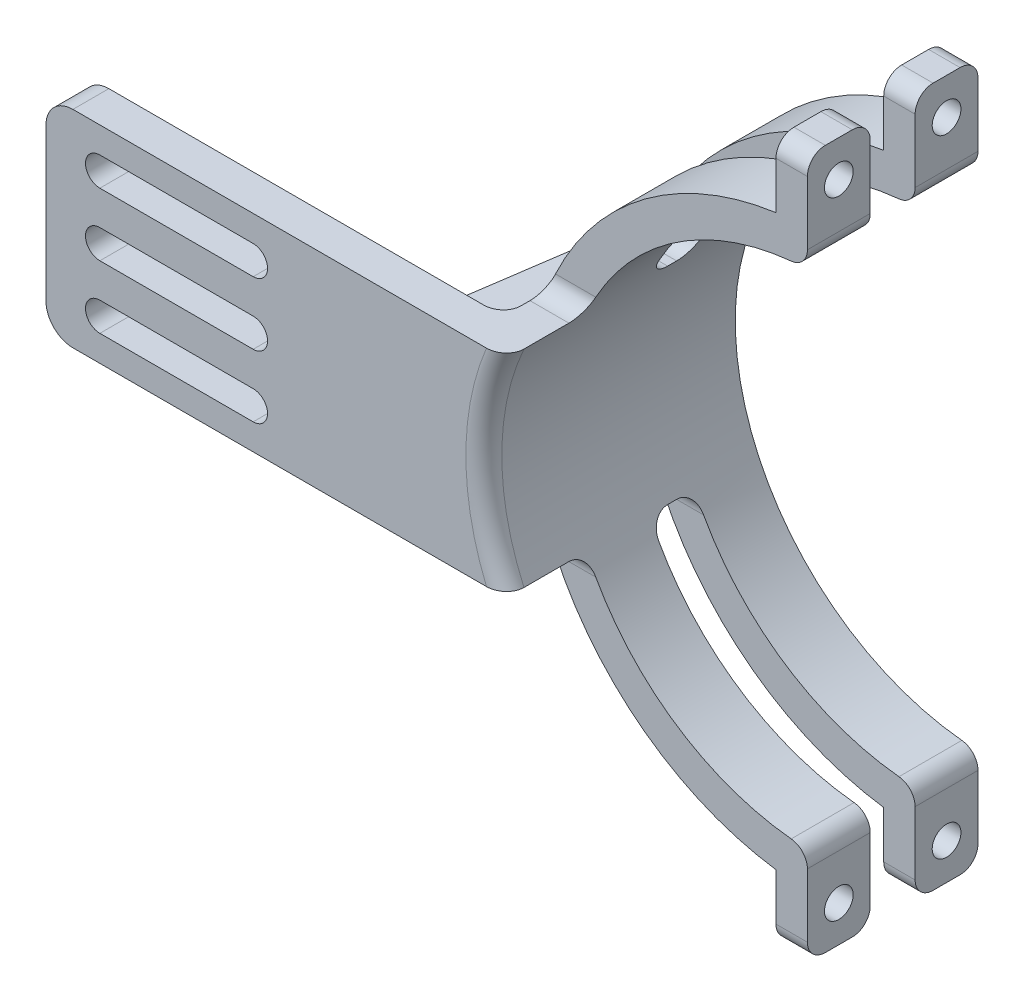
from build123d import *

# Parameters (mm, degrees)
EXTRUDE_1_DEPTH      = 3
SKETCH_7_R           = 2.2499999999999996
SKETCH_7_R_2         = 2.249999999999999
CUT_EXTRUDE_2_DEPTH  = 143.9554309486725
SKETCH_8_R           = 8
CUT_EXTRUDE_3_DEPTH  = 143.9554309486725
CUT_EXTRUDE_4_DEPTH  = 3
CUT_EXTRUDE_5_DEPTH  = 3
CUT_EXTRUDE_8_DEPTH  = 3
SKETCH_12_R          = 1.6999999999999977
SKETCH_12_R_2        = 1.6999999999999975
SKETCH_12_R_3        = 1.7000000000000015
SKETCH_12_R_4        = 1.7000000000000024
CUT_EXTRUDE_9_DEPTH  = 3
SKETCH_13_R          = 1.6999999999999977
SKETCH_13_R_2        = 1.7000000000000015
SKETCH_13_R_3        = 1.6999999999999973
CUT_EXTRUDE_11_DEPTH = 3
CUT_EXTRUDE_12_DEPTH = 143.9554309486725
FILLET_1_R           = 2
FILLET_2_R           = 2
CUT_EXTRUDE_13_DEPTH = 143.9554309486725
CUT_EXTRUDE_14_DEPTH = 143.9554309486725
CUT_EXTRUDE_15_DEPTH = 143.9554309486725
CUT_EXTRUDE_16_DEPTH = 143.9554309486725
EXTRUDE_2_DEPTH      = 4
SKETCH_20_W          = 4
SKETCH_20_H          = 23
EXTRUDE_3_DEPTH      = 5
EXTRUDE_4_DEPTH      = 7
EXTRUDE_5_DEPTH      = 9
CUT_EXTRUDE_17_DEPTH = 5
EXTRUDE_6_DEPTH      = 5
EXTRUDE_7_DEPTH      = 7
SKETCH_26_R          = 1.6000000000000008
SKETCH_26_R_2        = 1.5999999999999974
SKETCH_26_R_3        = 1.5999999999999908
SKETCH_26_R_4        = 1.5999999999999979
CUT_EXTRUDE_18_DEPTH = 27.000000000000004
FILLET_3_R           = 2
FILLET_4_R           = 2
FILLET_5_R           = 2
FILLET_6_R           = 2
FILLET_7_R           = 2
FILLET_8_R           = 2
FILLET_9_R           = 2
FILLET_10_R          = 2
FILLET_11_R          = 2
FILLET_12_R          = 2
SKETCH_29_W          = 19.839717489785563
SKETCH_29_H          = 23.000000000000004
EXTRUDE_8_DEPTH      = 4
CUT_EXTRUDE_21_DEPTH = 10
FILLET_13_R          = 3
EXTRUDE_START        = -24
EXTRUDE_9_DEPTH      = 24
CUT_EXTRUDE_22_DEPTH = 10
FILLET_14_R          = 3
EXTRUDE_10_DEPTH     = 4
SKETCH_42_W          = 21.709593228890974
SKETCH_42_H          = 23.000000000000007
EXTRUDE_11_DEPTH     = 4
CUT_EXTRUDE_23_DEPTH = 10
FILLET_15_R          = 3
SKETCH_44_W          = 31.295070260946716
SKETCH_44_H          = 95.84115267414583
CUT_EXTRUDE_24_DEPTH = 30


# Read off the part's stored shape, not the designer's step: 切除-拉伸19
with BuildPart() as part:
    # 草图1 → 凸台-拉伸1 (new body)
    # profile 1 of 14: a face of its own
    with BuildSketch(Plane.XY):
        with BuildLine():
            Line((59.99999999999994, 106.6032960019551), (35.88916363361177, 121.66451915871228))
            Line((35.88916363361177, 121.66451915871228), (-35.88916363361177, 121.66451915871227))
            Line((-35.88916363361177, 121.66451915871227), (-59.99999999999998, 106.60329600195507))
            Line((-59.99999999999998, 106.60329600195509), (-59.99999999999998, 94.80189226525114))
            Line((-59.999999999999964, 94.80189226525113), (-44.999999999999964, 94.80189226525111))
            ThreePointArc((-44.999999999999964, 94.80189226525111), (-43.7625631329235, 94.28932913232757), (-43.24999999999996, 93.05189226525111))
            Line((-43.24999999999996, 93.05189226525111), (-37.74999999999997, 93.05189226525111))
            ThreePointArc((-37.74999999999997, 93.05189226525111), (-37.237436867076426, 94.28932913232757), (-35.999999999999964, 94.80189226525111))
            Line((-35.999999999999964, 94.80189226525111), (-20.999999999999964, 94.80189226525111))
            ThreePointArc((-20.999999999999964, 94.80189226525111), (-19.762563132923507, 94.28932913232757), (-19.249999999999964, 93.05189226525111))
            Line((-19.249999999999957, 93.05189226525111), (19.249999999999986, 93.05189226525111))
            ThreePointArc((19.24999999999998, 93.05189226525111), (19.76256313292352, 94.28932913232757), (20.99999999999998, 94.80189226525111))
            Line((20.99999999999998, 94.80189226525111), (35.99999999999998, 94.80189226525111))
            ThreePointArc((35.99999999999998, 94.80189226525111), (37.23743686707644, 94.28932913232757), (37.749999999999986, 93.05189226525111))
            Line((37.749999999999986, 93.05189226525111), (43.249999999999986, 93.05189226525111))
            ThreePointArc((43.24999999999997, 93.05189226525111), (43.76256313292352, 94.28932913232757), (44.99999999999998, 94.80189226525111))
            Line((44.99999999999998, 94.80189226525111), (59.99999999999997, 94.80189226525113))
            Line((59.99999999999997, 94.80189226525113), (59.99999999999997, 106.6032960019551))
        make_face()
    # profile 2 of 14: a face of its own
    with BuildSketch(Plane.XY):
        with BuildLine():
            Line((66.90169409482209, 102.29204137178812), (59.99999999999994, 106.6032960019551))
            Line((59.99999999999997, 106.6032960019551), (59.99999999999997, 94.80189226525113))
            ThreePointArc((59.99999999999997, 94.80189226525113), (61.23743686707643, 94.28932913232758), (61.74999999999998, 93.05189226525113))
            Line((61.749999999999986, 93.05189226525111), (66.9016940948221, 93.05189226525111))
            Line((66.90169409482209, 93.05189226525111), (66.90169409482209, 102.29204137178812))
        make_face()
    # profile 3 of 14: a face of its own
    with BuildSketch(Plane.XY):
        with BuildLine():
            Line((-59.99999999999998, 94.80189226525114), (-59.99999999999998, 106.60329600195509))
            Line((-59.99999999999998, 106.60329600195507), (-66.90169409482209, 102.2920413717881))
            Line((-66.90169409482209, 102.2920413717881), (-66.90169409482209, 93.05189226525111))
            Line((-66.90169409482209, 93.05189226525111), (-61.74999999999997, 93.05189226525111))
            ThreePointArc((-61.74999999999997, 93.05189226525113), (-61.237436867076426, 94.28932913232758), (-59.999999999999964, 94.80189226525113))
        make_face()
    # profile 4 of 14: a face of its own
    with BuildSketch(Plane.XY):
        with BuildLine():
            Line((66.90169409482212, 63.05189226525111), (66.90169409482209, 93.05189226525111))
            Line((66.9016940948221, 93.05189226525111), (61.749999999999986, 93.05189226525111))
            ThreePointArc((61.74999999999998, 93.05189226525113), (61.23743686707643, 91.81445539817466), (59.99999999999997, 91.30189226525113))
            Line((59.99999999999998, 91.30189226525113), (59.99999999999998, 64.80189226525113))
            ThreePointArc((59.99999999999998, 64.8018922652511), (61.23743686707643, 64.28932913232755), (61.74999999999997, 63.0518922652511))
            Line((61.749999999999986, 63.05189226525111), (66.9016940948221, 63.05189226525111))
        make_face()
    # profile 5 of 14: a face of its own
    with BuildSketch(Plane.XY):
        with BuildLine():
            Line((-61.74999999999997, 93.05189226525111), (-66.90169409482209, 93.05189226525111))
            Line((-66.90169409482209, 93.05189226525111), (-66.90169409482209, 63.05189226525111))
            Line((-66.90169409482209, 63.05189226525111), (-61.74999999999997, 63.05189226525111))
            ThreePointArc((-61.74999999999997, 63.0518922652511), (-61.237436867076426, 64.28932913232755), (-59.999999999999964, 64.8018922652511))
            Line((-59.99999999999999, 64.8018922652511), (-59.99999999999998, 91.30189226525114))
            ThreePointArc((-59.999999999999964, 91.30189226525113), (-61.237436867076426, 91.81445539817467), (-61.74999999999997, 93.05189226525113))
        make_face()
    # profile 6 of 14: a face of its own
    with BuildSketch(Plane.XY):
        with BuildLine():
            Line((66.90169409482212, 52.870133869290264), (66.90169409482212, 63.05189226525111))
            Line((66.9016940948221, 63.05189226525111), (61.749999999999986, 63.05189226525111))
            ThreePointArc((61.74999999999997, 63.0518922652511), (61.23743686707643, 61.814455398174644), (59.99999999999998, 61.3018922652511))
            Line((59.99999999999998, 61.301892265251126), (59.999999999999986, 31.261343000504525))
            Line((59.999999999999986, 31.261343000504528), (75.00000000000001, 31.26134300050453))
            Line((75.00000000000001, 31.26134300050453), (75.00000000000001, 40.93388979542704))
            ThreePointArc((75.00000000000001, 40.93388979542704), (69.11735192662594, 45.6580523194762), (66.90169409482212, 52.870133869290264))
        make_face()
    # profile 7 of 14: a face of its own
    with BuildSketch(Plane.XY):
        with BuildLine():
            Line((59.99999999999998, 64.80189226525113), (59.99999999999998, 91.30189226525113))
            Line((59.99999999999997, 91.30189226525113), (44.99999999999998, 91.30189226525111))
            ThreePointArc((44.99999999999998, 91.30189226525111), (43.76256313292352, 91.81445539817466), (43.24999999999997, 93.05189226525111))
            Line((43.249999999999986, 93.05189226525111), (37.749999999999986, 93.05189226525111))
            ThreePointArc((37.749999999999986, 93.05189226525111), (37.23743686707644, 91.81445539817466), (35.99999999999998, 91.30189226525111))
            Line((35.99999999999998, 91.30189226525111), (20.99999999999998, 91.30189226525111))
            ThreePointArc((20.99999999999998, 91.30189226525111), (19.76256313292352, 91.81445539817466), (19.24999999999998, 93.05189226525111))
            Line((19.249999999999986, 93.05189226525111), (-19.249999999999957, 93.05189226525111))
            ThreePointArc((-19.249999999999964, 93.05189226525111), (-19.762563132923507, 91.81445539817466), (-20.999999999999964, 91.30189226525111))
            Line((-20.999999999999964, 91.30189226525111), (-35.999999999999964, 91.30189226525111))
            ThreePointArc((-35.999999999999964, 91.30189226525111), (-37.237436867076426, 91.81445539817466), (-37.74999999999997, 93.05189226525111))
            Line((-37.74999999999997, 93.05189226525111), (-43.24999999999996, 93.05189226525111))
            ThreePointArc((-43.24999999999996, 93.05189226525111), (-43.7625631329235, 91.81445539817466), (-44.999999999999964, 91.30189226525111))
            Line((-44.999999999999964, 91.30189226525111), (-59.999999999999964, 91.30189226525113))
            Line((-59.99999999999998, 91.30189226525114), (-59.99999999999999, 64.8018922652511))
            Line((-59.999999999999964, 64.8018922652511), (-44.999999999999964, 64.80189226525111))
            ThreePointArc((-44.999999999999964, 64.80189226525111), (-43.7625631329235, 64.28932913232757), (-43.24999999999996, 63.05189226525111))
            Line((-43.24999999999996, 63.05189226525111), (-37.74999999999997, 63.05189226525111))
            ThreePointArc((-37.74999999999997, 63.05189226525111), (-37.237436867076426, 64.28932913232757), (-35.999999999999964, 64.80189226525111))
            Line((-35.999999999999964, 64.80189226525111), (-20.999999999999964, 64.80189226525111))
            ThreePointArc((-20.999999999999964, 64.80189226525111), (-19.762563132923507, 64.28932913232757), (-19.249999999999964, 63.05189226525111))
            Line((-19.249999999999957, 63.05189226525111), (19.24999999999997, 63.05189226525111))
            ThreePointArc((19.24999999999997, 63.05189226525111), (19.762563132923514, 64.28932913232757), (20.99999999999997, 64.80189226525111))
            Line((20.99999999999997, 64.80189226525111), (35.99999999999997, 64.80189226525111))
            ThreePointArc((35.99999999999997, 64.80189226525111), (37.23743686707643, 64.28932913232757), (37.74999999999998, 63.05189226525111))
            Line((37.749999999999986, 63.05189226525111), (43.24999999999996, 63.05189226525111))
            ThreePointArc((43.249999999999964, 63.05189226525111), (43.76256313292351, 64.28932913232757), (44.99999999999997, 64.80189226525111))
            Line((44.99999999999997, 64.80189226525111), (59.99999999999998, 64.80189226525113))
        make_face()
    # profile 8 of 14: a face of its own
    with BuildSketch(Plane.XY):
        with BuildLine():
            Line((-61.74999999999997, 63.05189226525111), (-66.90169409482209, 63.05189226525111))
            Line((-66.90169409482209, 63.05189226525111), (-66.90169409482209, 52.87013386929025))
            ThreePointArc((-66.90169409482209, 52.87013386929025), (-69.11735192662591, 45.65805231947618), (-74.99999999999999, 40.93388979542702))
            Line((-74.99999999999999, 40.93388979542702), (-74.99999999999999, 31.26134300050451))
            Line((-74.99999999999999, 31.26134300050451), (-60, 31.261343000504514))
            Line((-60, 31.26134300050451), (-59.99999999999999, 61.3018922652511))
            ThreePointArc((-59.999999999999964, 61.30189226525109), (-61.237436867076426, 61.81445539817464), (-61.74999999999997, 63.0518922652511))
        make_face()
    # profile 9 of 14: a face of its own
    with BuildSketch(Plane.XY):
        with BuildLine():
            Line((59.999999999999986, 31.261343000504525), (59.99999999999998, 61.301892265251126))
            Line((59.99999999999998, 61.30189226525112), (44.99999999999997, 61.30189226525111))
            ThreePointArc((44.99999999999997, 61.301892265251105), (43.76256313292351, 61.81445539817465), (43.249999999999964, 63.05189226525111))
            Line((43.24999999999996, 63.05189226525111), (37.749999999999986, 63.05189226525111))
            ThreePointArc((37.74999999999998, 63.05189226525111), (37.23743686707643, 61.81445539817465), (35.99999999999997, 61.301892265251105))
            Line((35.99999999999997, 61.30189226525111), (20.99999999999997, 61.30189226525111))
            ThreePointArc((20.99999999999997, 61.30189226525111), (19.762563132923514, 61.81445539817465), (19.24999999999997, 63.05189226525111))
            Line((19.24999999999997, 63.05189226525111), (-19.249999999999957, 63.05189226525111))
            ThreePointArc((-19.249999999999964, 63.05189226525111), (-19.762563132923507, 61.81445539817465), (-20.999999999999964, 61.30189226525111))
            Line((-20.999999999999964, 61.30189226525111), (-35.999999999999964, 61.30189226525111))
            ThreePointArc((-35.999999999999964, 61.301892265251105), (-37.237436867076426, 61.81445539817465), (-37.74999999999997, 63.05189226525111))
            Line((-37.74999999999997, 63.05189226525111), (-43.24999999999996, 63.05189226525111))
            ThreePointArc((-43.24999999999996, 63.05189226525111), (-43.7625631329235, 61.81445539817465), (-44.999999999999964, 61.301892265251105))
            Line((-44.999999999999964, 61.30189226525111), (-59.999999999999964, 61.3018922652511))
            Line((-59.99999999999999, 61.3018922652511), (-60, 31.26134300050451))
            Line((-60, 31.261343000504514), (59.999999999999986, 31.261343000504528))
        make_face()
    # profile 10 of 14: a face of its own
    with BuildSketch(Plane.XY):
        with BuildLine():
            Line((60.00000000000001, -58.31286428889716), (59.999999999999986, 23.940028390779446))
            Line((59.999999999999986, 23.940028390779425), (-60, 23.94002839077941))
            Line((-60, 23.940028390779403), (-60.00000000000003, -58.31286428889722))
            Line((-60.00000000000003, -58.31286428889722), (-44.99999999999997, -58.31286428889719))
            ThreePointArc((-44.99999999999997, -58.312864288897195), (-43.24999999999989, -60.06286428889721), (-44.99999999999997, -61.812864288897224))
            Line((-44.99999999999997, -61.812864288897224), (-60.00000000000006, -61.81286428889722))
            Line((-60.00000000000006, -61.81286428889722), (-60.00000000000002, -88.31286428889688))
            Line((-60.00000000000002, -88.31286428889688), (-44.99999999999999, -88.31286428889679))
            ThreePointArc((-44.99999999999999, -88.31286428889678), (-43.25000000000038, -90.06286428889678), (-44.99999999999999, -91.81286428889678))
            Line((-44.99999999999999, -91.81286428889679), (-60.000000000000014, -91.81286428889689))
            Line((-60.000000000000014, -91.81286428889689), (-60, -111.8499672560037))
            Line((-60, -111.8499672560037), (-38.845469114440476, -105.59057673322376))
            ThreePointArc((-38.845469114440476, -105.59057673322376), (-36.03778449152867, -104.97521010805474), (-33.170885730154765, -104.76866588242706))
            Line((-33.170885730154765, -104.76866588242706), (33.17088573015482, -104.76866588242706))
            ThreePointArc((33.17088573015482, -104.76866588242706), (36.03778449152872, -104.97521010805474), (38.84546911444053, -105.59057673322376))
            Line((38.84546911444053, -105.59057673322376), (60.000000000000014, -111.84996725600368))
            Line((60.000000000000014, -111.84996725600368), (60.00000000000001, -91.81286428889712))
            Line((60.00000000000007, -91.81286428889712), (45.00000000000003, -91.81286428889699))
            ThreePointArc((45.00000000000003, -91.81286428889699), (43.762563132922956, -91.30030115597347), (43.24999999999931, -90.06286428889646))
            ThreePointArc((43.24999999999931, -90.06286428889646), (43.76256313292323, -88.82542742181997), (45.00000000000002, -88.31286428889673))
            Line((45.00000000000002, -88.31286428889673), (60.00000000000006, -88.31286428889713))
            Line((60.00000000000001, -88.31286428889713), (60.00000000000001, -61.812864288897174))
            Line((60.00000000000001, -61.81286428889717), (45.000000000000036, -61.81286428889717))
            ThreePointArc((45.000000000000036, -61.812864288897174), (43.762563132923574, -61.300301155973635), (43.250000000000014, -60.062864288897174))
            ThreePointArc((43.250000000000014, -60.062864288897174), (43.76256313292355, -58.82542742182069), (45.000000000000036, -58.31286428889713))
            Line((45.000000000000036, -58.31286428889713), (60.00000000000001, -58.31286428889716))
        make_face()
        with BuildLine():
            ThreePointArc((-20.999999999999964, -88.31286428889648), (-19.76256313292351, -88.82542742182001), (-19.249999999999964, -90.06286428889646))
            ThreePointArc((-19.249999999999964, -90.06286428889646), (-19.7625631329235, -91.30030115597293), (-20.999999999999964, -91.81286428889648))
            Line((-20.999999999999964, -91.81286428889648), (-35.999999999999964, -91.81286428889648))
            ThreePointArc((-35.999999999999964, -91.81286428889648), (-37.74999999999999, -90.06286428889648), (-35.999999999999964, -88.31286428889648))
            Line((-35.999999999999964, -88.31286428889648), (-20.999999999999964, -88.31286428889648))
        make_face(mode=Mode.SUBTRACT)
        with BuildLine():
            ThreePointArc((-20.999999999999964, -58.31286428889723), (-19.762563132923184, -58.82542742182099), (-19.249999999999854, -60.06286428889795))
            ThreePointArc((-19.249999999999854, -60.06286428889795), (-19.762563132923688, -61.30030115597399), (-20.999999999999964, -61.812864288897245))
            Line((-20.999999999999964, -61.812864288897245), (-35.99999999999992, -61.81286428889731))
            ThreePointArc((-35.99999999999992, -61.81286428889731), (-37.75000000000054, -60.06286428889735), (-36.000000000000014, -58.31286428889731))
            Line((-36.000000000000014, -58.3128642888973), (-20.999999999999964, -58.31286428889723))
        make_face(mode=Mode.SUBTRACT)
        with BuildLine():
            ThreePointArc((36.00000000000002, -88.31286428889648), (37.23743686707648, -88.82542742182002), (37.75000000000002, -90.06286428889649))
            ThreePointArc((37.75000000000002, -90.06286428889649), (37.237436867076475, -91.30030115597295), (36.00000000000002, -91.81286428889648))
            Line((36.00000000000002, -91.81286428889648), (21.000000000000018, -91.81286428889648))
            ThreePointArc((21.000000000000018, -91.81286428889648), (19.762563132923546, -91.30030115597292), (19.250000000000018, -90.06286428889644))
            ThreePointArc((19.250000000000018, -90.06286428889644), (19.762563132923574, -88.82542742182001), (21.000000000000018, -88.31286428889648))
            Line((21.000000000000018, -88.31286428889648), (36.00000000000002, -88.31286428889648))
        make_face(mode=Mode.SUBTRACT)
        with BuildLine():
            ThreePointArc((36.00000000000001, -58.31286428889745), (37.2374368670764, -58.825427421820926), (37.75000000000002, -60.06286428889725))
            ThreePointArc((37.75000000000002, -60.06286428889725), (37.23743686707655, -61.30030115597386), (36.00000000000001, -61.812864288897494))
            Line((36.00000000000001, -61.812864288897494), (21.000000000000004, -61.812864288897494))
            ThreePointArc((21.000000000000004, -61.812864288897494), (19.762563132923542, -61.30030115597395), (19.249999999999993, -60.06286428889749))
            ThreePointArc((19.249999999999993, -60.06286428889749), (19.762563132923532, -58.82542742182101), (21.000000000000004, -58.31286428889745))
            Line((21.000000000000004, -58.31286428889745), (36.00000000000001, -58.31286428889745))
        make_face(mode=Mode.SUBTRACT)
    # profile 11 of 14: a face of its own
    with BuildSketch(Plane.XY):
        with BuildLine():
            Line((75.00000000000001, 23.94002839077943), (59.999999999999986, 23.940028390779425))
            Line((59.999999999999986, 23.940028390779446), (60.00000000000001, -58.31286428889716))
            ThreePointArc((60.00000000000001, -58.31286428889715), (61.237436867076404, -58.82542742182061), (61.750000000000036, -60.06286428889695))
            Line((61.750000000000036, -60.06286428889696), (67.40272133408746, -60.06286428889689))
            add(Edge.make_bspline(
                [(75.00000000000001, 10.562559835431854), (72.69587825706628, 1.9073142333592985), (70.33958253529204, -13.372796252870137), (67.81820670408499, -36.93903295106657), (67.20886038798805, -51.77269444017321), (67.40272133408746, -60.06286428889608)],
                knots=[0, 0, 0, 0, 0.23524667827066936, 0.40629418957963404, 0.6241081814572702, 0.6241081814572702, 0.6241081814572702, 0.6241081814572702], degree=3))
            Line((75.00000000000001, 10.562559835431854), (75.00000000000001, 23.94002839077943))
        make_face()
    # profile 12 of 14: a face of its own
    with BuildSketch(Plane.XY):
        with BuildLine():
            Line((-60.00000000000003, -58.31286428889722), (-60, 23.940028390779403))
            Line((-60, 23.94002839077941), (-74.99999999999999, 23.94002839077941))
            Line((-74.99999999999999, 23.94002839077941), (-74.99999999999999, 10.562559835431834))
            add(Edge.make_bspline(
                [(-74.99999999999999, 10.562559835431834), (-72.69587825706623, 1.9073142333592807), (-70.33958253529205, -13.372796252870154), (-67.81820670408486, -36.93903295106704), (-67.20886038798794, -51.77269444017414), (-67.40272133408743, -60.06286428889747)],
                knots=[0, 0, 0, 0, 0.23524667827066936, 0.40629418957963404, 0.6241081814572824, 0.6241081814572824, 0.6241081814572824, 0.6241081814572824], degree=3))
            add(Edge.make_bspline(
                [(-67.40272133408743, -60.06286428889747), (-67.56032587245761, -66.80258375435272), (-68.323504015194, -76.84367009307445), (-70.1541319554568, -86.77853007567795), (-70.53371285765535, -90.06286428889649)],
                knots=[0.6241081814572824, 0.6241081814572824, 0.6241081814572824, 0.6241081814572824, 0.8011860010549554, 0.8884086519703641, 0.8884086519703641, 0.8884086519703641, 0.8884086519703641], degree=3))
            add(Edge.make_bspline(
                [(-70.53371285765536, -90.06286428889649), (-71.01934295623744, -94.26479209533699), (-71.13742293500087, -98.47604820555091), (-70.17426240042177, -102.73279405880234)],
                knots=[0.8884086519703641, 0.8884086519703641, 0.8884086519703641, 0.8884086519703641, 1, 1, 1, 1], degree=3))
            Line((-70.17426240042177, -102.73279405880234), (-66.46081763531664, -113.76165137202992))
            Line((-66.46081763531664, -113.76165137202992), (-60, -111.8499672560037))
            Line((-60, -111.8499672560037), (-60.000000000000014, -91.81286428889689))
            ThreePointArc((-60.000000000000014, -91.81286428889688), (-61.75000000000035, -90.06286428889688), (-60.00000000000002, -88.31286428889688))
            Line((-60.00000000000002, -88.31286428889688), (-60.00000000000006, -61.81286428889722))
            ThreePointArc((-60.00000000000006, -61.81286428889722), (-61.749999999999986, -60.0628642888972), (-60.00000000000003, -58.31286428889722))
        make_face()
    # profile 13 of 14: a face of its own
    with BuildSketch(Plane.XY):
        with BuildLine():
            Line((67.40272133408746, -60.06286428889689), (61.750000000000036, -60.06286428889696))
            ThreePointArc((61.750000000000036, -60.06286428889695), (61.23743686707656, -61.30030115597356), (60.00000000000001, -61.81286428889717))
            Line((60.00000000000001, -61.812864288897174), (60.00000000000001, -88.31286428889713))
            ThreePointArc((60.00000000000006, -88.31286428889713), (61.23743686707617, -88.8254274218205), (61.749999999999865, -90.06286428889649))
            Line((61.74999999999987, -90.06286428889648), (70.53371285765562, -90.06286428889648))
            add(Edge.make_bspline(
                [(67.40272133408746, -60.06286428889608), (67.56032587245758, -66.80258375435179), (68.32350401519398, -76.8436700930743), (70.15413195545696, -86.77853007567856), (70.5337128576555, -90.0628642888974)],
                knots=[0.6241081814572702, 0.6241081814572702, 0.6241081814572702, 0.6241081814572702, 0.8011860010549554, 0.8884086519703727, 0.8884086519703727, 0.8884086519703727, 0.8884086519703727], degree=3))
        make_face()
    # profile 14 of 14: a face of its own
    with BuildSketch(Plane.XY):
        with BuildLine():
            add(Edge.make_bspline(
                [(70.5337128576555, -90.06286428889742), (71.0193429562375, -94.26479209533758), (71.13742293500084, -98.4760482055512), (70.17426240042182, -102.73279405880233)],
                knots=[0.8884086519703727, 0.8884086519703727, 0.8884086519703727, 0.8884086519703727, 1, 1, 1, 1], degree=3))
            Line((70.53371285765562, -90.06286428889648), (61.74999999999987, -90.06286428889648))
            ThreePointArc((61.749999999999865, -90.06286428889649), (61.23743686707662, -91.30030115597327), (60.00000000000007, -91.8128642888971))
            Line((60.00000000000001, -91.81286428889712), (60.000000000000014, -111.84996725600368))
            Line((60.000000000000014, -111.84996725600368), (66.46081763531669, -113.76165137202992))
            Line((66.46081763531669, -113.76165137202992), (70.17426240042177, -102.73279405880234))
        make_face()
    extrude(amount=EXTRUDE_1_DEPTH)

    # 草图7 → 切除-拉伸2 (cut, through all)
    with BuildSketch(Plane(origin=(0, 0, 0), x_dir=(-1, 0, 0), z_dir=(0, 0, -1))):
        with Locations((-20.99999999999999, 41.26134300050451)):
            Circle(SKETCH_7_R)
        with Locations((21.00000000000001, 41.26134300050451)):
            Circle(SKETCH_7_R)
        with Locations((-20.999999999999986, 13.940028390779407)):
            Circle(SKETCH_7_R_2)
        with Locations((21.000000000000014, 13.94002839077941)):
            Circle(SKETCH_7_R_2)
    extrude(amount=-CUT_EXTRUDE_2_DEPTH, mode=Mode.SUBTRACT)

    # 草图8 → 切除-拉伸3 (cut, through all)
    with BuildSketch(Plane.XY.offset(3)):
        with BuildLine():
            Line((-12.621438714311319, -0.37855794544282684), (-33.40901034462534, 20.409013684871184))
            ThreePointArc((-33.40901034462534, 20.409013684871184), (-36.59099943422989, 20.40901364306184), (-36.59099930880186, 17.227024553457287))
            Line((-36.59099930880186, 17.227024553457287), (-15.803426585945267, -3.560545984314082))
            ThreePointArc((-15.803426585945267, -3.5605459843140808), (-12.621438672501986, -3.560545858886111), (-12.621438714311319, -0.37855794544282695))
        make_face()
        with BuildLine():
            Line((33.41046205612755, 20.410458797881883), (12.572988319328147, -0.4270108235691197))
            ThreePointArc((12.572988319327871, -0.42701082356886033), (12.644570440569202, -3.5847649934052432), (15.803045701641096, -3.560902420256042))
            Line((15.803045701641098, -3.560902420256043), (34.99999998205021, 15.636052773684106))
            Line((34.99999998205021, 15.636052773684106), (36.5880869521281, 17.22413981933475))
            ThreePointArc((36.5880869521281, 17.22413981933475), (36.59243399340139, 20.406111756608592), (33.41046205612755, 20.410458797881883))
        make_face()
        with BuildLine():
            Line((-15.803784811617428, -28.803778350173733), (-36.59100218625151, -49.590991619384916))
            ThreePointArc((-36.59100218625151, -49.590991619384916), (-36.591002402986206, -52.772972232183115), (-33.409021790188, -52.77297225395409))
            Line((-33.409021790188, -52.77297225395409), (-12.573723915912868, -31.937673388183576))
            ThreePointArc((-12.573723915912868, -31.937673388183576), (-12.645306280144124, -28.779915954044938), (-15.803784811617428, -28.803778350173733))
        make_face()
        with BuildLine():
            Line((36.59099266643557, -49.59098932618961), (15.803414626556833, -28.803411286310908))
            ThreePointArc((15.803414626556835, -28.803411286310908), (12.654338963515047, -28.7697743019421), (12.553443359950268, -31.917412949477868))
            Line((12.553443359950265, -31.91741294947787), (33.40900738128343, -52.77297477857893))
            ThreePointArc((33.40900738128343, -52.77297477857893), (36.59099270824486, -52.772974653151046), (36.59099266643557, -49.59098932618961))
        make_face()
        with Locations((-0.00036878160574946, -16.182341353605377)):
            Circle(SKETCH_8_R)
    extrude(amount=-CUT_EXTRUDE_3_DEPTH, mode=Mode.SUBTRACT)

    # 草图9 → 切除-拉伸4 (cut)
    with BuildSketch(Plane.XY.offset(3)):
        with BuildLine():
            Line((55.000000000000036, -100.49704609007622), (20.000000000000032, -100.49704609007622))
            ThreePointArc((20.000000000000032, -100.49704609007622), (18.250000000000032, -98.74704609007622), (20.000000000000032, -96.99704609007622))
            Line((20.000000000000032, -96.99704609007622), (55.000000000000036, -96.99704609007622))
            ThreePointArc((55.000000000000036, -96.99704609007622), (56.750000000000036, -98.74704609007622), (55.000000000000036, -100.49704609007622))
        make_face()
        with BuildLine():
            Line((-54.99999999999998, -96.99704609007622), (-19.999999999999975, -96.99704609007622))
            ThreePointArc((-19.999999999999975, -96.99704609007622), (-18.249999999999975, -98.74704609007622), (-19.999999999999975, -100.49704609007622))
            Line((-19.999999999999975, -100.49704609007622), (-54.99999999999998, -100.49704609007622))
            ThreePointArc((-54.99999999999998, -100.49704609007622), (-56.74999999999998, -98.74704609007622), (-54.99999999999998, -96.99704609007622))
        make_face()
    extrude(amount=-CUT_EXTRUDE_4_DEPTH, mode=Mode.SUBTRACT)

    # 草图10 → 切除-拉伸5 (cut)
    with BuildSketch(Plane.XY.offset(3)):
        with BuildLine():
            Line((12.500000000000218, -80.06286428889683), (-12.499999999999915, -80.06286428889685))
            ThreePointArc((-12.499999999999915, -80.06286428889685), (-17.499999999999964, -75.06286428889683), (-12.499999999999966, -70.0628642888968))
            Line((-12.499999999999966, -70.0628642888968), (12.500000000000068, -70.0628642888968))
            ThreePointArc((12.500000000000068, -70.0628642888968), (17.500000000000064, -75.06286428889673), (12.500000000000218, -80.06286428889683))
        make_face()
    extrude(amount=-CUT_EXTRUDE_5_DEPTH, mode=Mode.SUBTRACT)

    # 草图11 → 切除-拉伸8 (cut)
    with BuildSketch(Plane.XY.offset(3)):
        with BuildLine():
            Line((15.000000000000004, 73.05189226525113), (-14.999999999999998, 73.05189226525113))
            ThreePointArc((-14.999999999999998, 73.05189226525113), (-19.999999999999996, 78.05189226525111), (-14.999999999999996, 83.05189226525111))
            Line((-14.999999999999996, 83.05189226525111), (15.000000000000004, 83.05189226525111))
            ThreePointArc((15.000000000000004, 83.05189226525111), (19.99999999999999, 78.05189226525111), (15.000000000000004, 73.05189226525113))
        make_face()
    extrude(amount=-CUT_EXTRUDE_8_DEPTH, mode=Mode.SUBTRACT)

    # 草图12 → 切除-拉伸9 (cut)
    with BuildSketch(Plane.XY.offset(3)):
        with Locations((0, 114.37178643513211)):
            Circle(SKETCH_12_R)
        with Locations((0, 98.3717864351321)):
            Circle(SKETCH_12_R_2)
        with Locations((8.000000000000002, 106.37178643513211)):
            Circle(SKETCH_12_R_3)
        with Locations((-8.000000000000002, 106.37178643513211)):
            Circle(SKETCH_12_R_4)
    extrude(amount=-CUT_EXTRUDE_9_DEPTH, mode=Mode.SUBTRACT)

    # 草图13 → 切除-拉伸11 (cut)
    with BuildSketch(Plane.XY.offset(3)):
        with Locations((8.934e-14, -84.41576508566195)):
            Circle(SKETCH_13_R)
        with Locations((8.000000000000092, -92.41576508566195)):
            Circle(SKETCH_13_R_2)
        with Locations((8.934e-14, -100.41576508566196)):
            Circle(SKETCH_13_R_3)
        with Locations((-7.999999999999912, -92.41576508566195)):
            Circle(SKETCH_13_R_3)
    extrude(amount=-CUT_EXTRUDE_11_DEPTH, mode=Mode.SUBTRACT)

    # 草图14 → 切除-拉伸12 (cut, through all)
    with BuildSketch(Plane.XY.offset(3)):
        with BuildLine():
            Line((-55.47550156736941, 8.919687235970343), (-55.475501567369406, -46.08031276402966))
            ThreePointArc((-55.475501567369406, -46.08031276402966), (-57.225501567369406, -47.83031276402966), (-58.975501567369406, -46.08031276402966))
            Line((-58.975501567369406, -46.08031276402966), (-58.97550156736941, 8.919687235970343))
            ThreePointArc((-58.97550156736941, 8.919687235970343), (-57.22550156736941, 10.669687235970343), (-55.47550156736941, 8.919687235970343))
        make_face()
        with BuildLine():
            Line((58.97550156736944, 8.919687235970358), (58.97550156736945, -46.08031276402966))
            ThreePointArc((58.97550156736945, -46.08031276402966), (57.22550156736945, -47.83031276402966), (55.47550156736945, -46.08031276402966))
            Line((55.47550156736945, -46.08031276402966), (55.47550156736944, 8.919687235970354))
            ThreePointArc((55.47550156736944, 8.919687235970354), (57.22550156736944, 10.669687235970358), (58.97550156736944, 8.919687235970358))
        make_face()
    extrude(amount=-CUT_EXTRUDE_12_DEPTH, mode=Mode.SUBTRACT)

    # 圆角1
    fillet_1_edges = [part.edges().sort_by_distance(p)[0] for p in [
        (75.00000000000001, 31.26134300050453, 1.5),
        (-74.99999999999999, 31.26134300050451, 1.5),
    ]]
    fillet(fillet_1_edges, radius=FILLET_1_R)

    # 圆角2
    fillet_2_edges = [part.edges().sort_by_distance(p)[0] for p in [
        (-74.99999999999999, 23.94002839077941, 1.5),
        (75.00000000000001, 23.94002839077943, 1.5),
    ]]
    fillet(fillet_2_edges, radius=FILLET_2_R)

    # 草图15 → 切除-拉伸13 (cut, through all)
    with BuildSketch(Plane(origin=(0, 0, 0), x_dir=(-1, 0, 0), z_dir=(0, 0, -1))):
        with BuildLine():
            Line((-61.18421640135317, 102.40350127585891), (-34.77476286241414, 118.90059275595658))
            ThreePointArc((-34.77476286241414, 118.90059275595658), (-32.707881589653226, 118.42309741115184), (-33.18537693445796, 116.35621613839092))
            Line((-33.18537693445796, 116.35621613839092), (-59.59483047339698, 99.85912465829324))
            ThreePointArc((-59.59483047339698, 99.85912465829324), (-61.66171174615792, 100.33662000309798), (-61.18421640135317, 102.40350127585891))
        make_face()
        with BuildLine():
            Line((59.59483047339698, 99.85912465829323), (33.18537693445796, 116.35621613839092))
            ThreePointArc((33.18537693445796, 116.35621613839092), (32.70788158965324, 118.42309741115183), (34.77476286241414, 118.90059275595657))
            Line((34.77476286241414, 118.90059275595657), (61.18421640135317, 102.4035012758589))
            ThreePointArc((61.18421640135317, 102.4035012758589), (61.66171174615792, 100.33662000309796), (59.59483047339698, 99.85912465829323))
        make_face()
    extrude(amount=-CUT_EXTRUDE_13_DEPTH, mode=Mode.SUBTRACT)

    # 草图16 → 切除-拉伸14 (cut, through all)
    with BuildSketch(Plane(origin=(0, 0, 0), x_dir=(-1, 0, 0), z_dir=(0, 0, -1))):
        with BuildLine():
            Line((-61.516979466690685, 42.7613430005045), (-32.056291893000356, 42.76134300050451))
            ThreePointArc((-32.056291893000356, 42.76134300050451), (-30.556291893000356, 41.26134300050451), (-32.056291893000356, 39.76134300050451))
            Line((-32.056291893000356, 39.76134300050451), (-61.516979466690685, 39.76134300050452))
            ThreePointArc((-61.516979466690685, 39.76134300050452), (-63.01697946669068, 41.26134300050451), (-61.516979466690685, 42.7613430005045))
        make_face()
        with BuildLine():
            Line((61.51697946669066, 39.761343000504546), (32.05629189300033, 39.76134300050457))
            ThreePointArc((32.05629189300033, 39.76134300050457), (30.556291893000328, 41.26134300050457), (32.05629189300033, 42.76134300050457))
            Line((32.05629189300033, 42.76134300050457), (61.51697946669066, 42.76134300050453))
            ThreePointArc((61.51697946669066, 42.76134300050453), (63.01697946669065, 41.26134300050454), (61.51697946669066, 39.761343000504546))
        make_face()
    extrude(amount=-CUT_EXTRUDE_14_DEPTH, mode=Mode.SUBTRACT)

    # 草图17 → 切除-拉伸15 (cut, through all)
    with BuildSketch(Plane(origin=(0, 0, 0), x_dir=(-1, 0, 0), z_dir=(0, 0, -1))):
        Polygon((-28.645414282738436, -8.118433382478688), (-34.644957411393406, -20.117519639788632), (-34.644957411393406, -29.94655838247869), (-37.58090404882031, -29.94655838247869), (-37.58090404882031, -20.117519639788632), (-43.58044717747528, -8.118433382478688), (-40.64450054004838, -8.118433382478688), (-36.17675565700744, -17.436872709964074), (-36.04910580320627, -17.436872709964074), (-31.581360920165334, -8.118433382478688), align=None)
    extrude(amount=-CUT_EXTRUDE_15_DEPTH, mode=Mode.SUBTRACT)

    # 草图18 → 切除-拉伸16 (cut, through all)
    with BuildSketch(Plane(origin=(0, 0, 0), x_dir=(-1, 0, 0), z_dir=(0, 0, -1))):
        Polygon((46.06697123049682, -29.08752979106243), (43.13102459306992, -29.08752979106243), (43.13102459306992, -18.875541486968864), (35.85498292640325, -18.875541486968864), (35.85498292640325, -29.08752979106243), (32.91903628897636, -29.08752979106243), (32.91903628897636, -7.259404791062428), (35.85498292640325, -7.259404791062428), (35.85498292640325, -16.45019426474664), (43.13102459306992, -16.45019426474664), (43.13102459306992, -7.259404791062428), (46.06697123049682, -7.259404791062428), align=None)
    extrude(amount=-CUT_EXTRUDE_16_DEPTH, mode=Mode.SUBTRACT)


with BuildPart() as body_2:
    # 草图19 → 凸台-拉伸2 (new body)
    with BuildSketch(Plane(origin=(0, 0, -10), x_dir=(-1, 0, 0), z_dir=(0, 0, -1))):
        Polygon((-61.72550156736945, -11.08595110283974), (-75.00000000000001, -11.085951102839742), (-75.00000000000001, -34.08595110283974), (-61.72550156736942, -34.08595110283975), (-52.725501567369484, -34.08595110283974), (-52.72550156736945, -11.08595110283974), align=None)
        with BuildLine():
            ThreePointArc((-58.97550156736945, -30.08595110283975), (-57.22550156736945, -31.83595110283975), (-55.47550156736946, -30.08595110283975))
            Line((-55.47550156736946, -30.08595110283975), (-55.47550156736947, -15.085951102839749))
            ThreePointArc((-55.47550156736947, -15.085951102839749), (-57.225501567369456, -13.335951102839765), (-58.975501567369456, -15.085951102839752))
            Line((-58.975501567369456, -15.085951102839752), (-58.97550156736945, -30.08595110283975))
        make_face(mode=Mode.SUBTRACT)
    extrude(amount=EXTRUDE_2_DEPTH)

    # 草图20 → 凸台-拉伸3 (add)
    with BuildSketch(Plane(origin=(0, 0, -14), x_dir=(-1, 0, 0), z_dir=(0, 0, -1))):
        with Locations((-73.00000000000001, -22.585951102839743)):
            Rectangle(SKETCH_20_W, SKETCH_20_H)
    extrude(amount=EXTRUDE_3_DEPTH)

    # 草图21 → 凸台-拉伸4 (add)
    with BuildSketch(Plane(origin=(0, 0, -19), x_dir=(-1, 0, 0), z_dir=(0, 0, -1))):
        with BuildLine():
            Line((-102.03333333333333, -61.51352874214651), (-98.53333333333333, -61.51352874214651))
            Line((-98.53333333333333, -61.51352874214651), (-98.53333333333332, -54.27268158878431))
            ThreePointArc((-98.53333333333332, -54.27268158878431), (-71.00000000000001, -22.585951102839736), (-98.53333333333333, 9.100779383104836))
            Line((-98.53333333333333, 9.100779383104836), (-98.53333333333335, 16.34162653646702))
            Line((-98.53333333333335, 16.34162653646702), (-102.03333333333335, 16.341626536467007))
            Line((-102.03333333333335, 16.341626536467007), (-102.03333333333332, 5.397357414123636))
            ThreePointArc((-102.03333333333332, 5.397357414123636), (-75.00000000000001, -22.585951102839743), (-102.03333333333332, -50.56925961980313))
            Line((-102.03333333333332, -50.56925961980313), (-102.03333333333333, -61.51352874214651))
        make_face()
        with BuildLine():
            Line((-108.03333333333336, 16.34162653646703), (-108.03333333333337, 4.957933074152349))
            ThreePointArc((-108.03333333333337, 4.957933074152349), (-131.00000000000003, -22.58595110283974), (-108.03333333333337, -50.12983527983184))
            Line((-108.03333333333337, -50.12983527983184), (-108.03333333333335, -61.51352874214651))
            Line((-108.03333333333335, -61.51352874214651), (-111.53333333333335, -61.51352874214652))
            Line((-111.53333333333335, -61.51352874214652), (-111.53333333333335, -53.42719333174846))
            ThreePointArc((-111.53333333333335, -53.42719333174846), (-135, -22.58595110283974), (-111.53333333333336, 8.255291126068972))
            Line((-111.53333333333336, 8.255291126068972), (-111.53333333333336, 16.34162653646702))
            Line((-111.53333333333336, 16.34162653646702), (-108.03333333333336, 16.34162653646703))
        make_face()
    extrude(amount=EXTRUDE_4_DEPTH)


with BuildPart() as extrude_4_piece_1:
    # of the separate pieces the step leaves, piece 1, a body of its own (extrude_4_pieces)
    add(body_2.part.solids().sort_by_distance((75, -11.085951103, -10))[0])

    # 草图22 → 凸台-拉伸5 (add)
    with BuildSketch(Plane.XY.offset(-19)):
        with BuildLine():
            Line((75.00000000000001, -11.085951102839742), (75.00000000000001, -22.585951102839743))
            ThreePointArc((75.00000000000001, -22.585951102839743), (75.62461822158177, -16.70475458462619), (77.47060517756051, -11.085951102839743))
            Line((77.47060517756051, -11.085951102839743), (75.00000000000001, -11.085951102839742))
        make_face()
        with BuildLine():
            ThreePointArc((75.00000000000001, -22.585951102839743), (75.62461822158178, -28.467147621053293), (77.47060517756051, -34.08595110283974))
            Line((77.47060517756051, -34.08595110283974), (75.00000000000001, -34.08595110283974))
            Line((75.00000000000001, -34.08595110283974), (75.00000000000001, -22.585951102839743))
        make_face()
    extrude(amount=EXTRUDE_5_DEPTH)

    # 草图23 → 切除-拉伸17 (cut)
    with BuildSketch(Plane(origin=(0, 0, -19), x_dir=(-1, 0, 0), z_dir=(0, 0, -1))):
        with BuildLine():
            ThreePointArc((-73.13781655672177, -11.085951102839743), (-71.5389934189567, -16.737441471527816), (-71.00000000000001, -22.585951102839743))
            Line((-71.00000000000001, -22.585951102839743), (-71.00000000000001, -11.085951102839742))
            Line((-71.00000000000001, -11.085951102839742), (-73.13781655672177, -11.085951102839743))
        make_face()
        with BuildLine():
            Line((-71.00000000000001, -34.08595110283974), (-71.00000000000001, -22.585951102839743))
            ThreePointArc((-71.00000000000001, -22.585951102839743), (-71.53899341895666, -28.434460734151678), (-73.13781655672177, -34.08595110283974))
            Line((-73.13781655672177, -34.08595110283974), (-71.00000000000001, -34.08595110283974))
        make_face()
    extrude(amount=-CUT_EXTRUDE_17_DEPTH, mode=Mode.SUBTRACT)

    # 草图24 → 凸台-拉伸6 (add)
    with BuildSketch(Plane(origin=(0, 0, -26), x_dir=(-1, 0, 0), z_dir=(0, 0, -1))):
        with BuildLine():
            ThreePointArc((-73.13781655672177, -34.08595110283974), (-71, -22.58595110283973), (-73.13781655672177, -11.08595110283973))
            Line((-73.13781655672179, -11.085951102839742), (-77.47060517756051, -11.085951102839743))
            ThreePointArc((-77.47060517756051, -11.085951102839743), (-75, -22.585951102839743), (-77.47060517756051, -34.08595110283975))
            Line((-77.47060517756053, -34.08595110283974), (-73.13781655672177, -34.08595110283974))
        make_face()
    extrude(amount=EXTRUDE_6_DEPTH)

    # 草图25 → 凸台-拉伸7 (add)
    with BuildSketch(Plane(origin=(0, 0, -31), x_dir=(-1, 0, 0), z_dir=(0, 0, -1))):
        with BuildLine():
            ThreePointArc((-77.47060517756051, -11.085951102839743), (-87.39759045772182, 0.6640987137741377), (-102.03333333333332, 5.397357414123636))
            Line((-102.03333333333332, 5.397357414123636), (-102.03333333333335, 16.341626536467007))
            Line((-102.03333333333335, 16.341626536467007), (-98.53333333333335, 16.34162653646702))
            Line((-98.53333333333335, 16.34162653646702), (-98.53333333333333, 9.100779383104836))
            ThreePointArc((-98.53333333333333, 9.100779383104836), (-83.0878552286348, 2.4641285498119316), (-73.13781655672177, -11.085951102839742))
            Line((-73.13781655672177, -11.085951102839742), (-77.47060517756051, -11.085951102839743))
        make_face()
        with BuildLine():
            ThreePointArc((-77.47060517756051, -11.085951102839743), (-75, -22.585951102839743), (-77.47060517756051, -34.08595110283974))
            Line((-77.47060517756051, -34.08595110283974), (-73.13781655672177, -34.08595110283974))
            ThreePointArc((-73.13781655672177, -34.08595110283974), (-71, -22.58595110283974), (-73.13781655672177, -11.085951102839742))
            Line((-73.13781655672177, -11.085951102839742), (-77.47060517756051, -11.085951102839743))
        make_face()
        with BuildLine():
            ThreePointArc((-102.03333333333332, -50.56925961980313), (-87.39759045772183, -45.83600091945361), (-77.47060517756051, -34.08595110283974))
            Line((-77.47060517756051, -34.08595110283974), (-73.13781655672179, -34.08595110283974))
            ThreePointArc((-73.13781655672179, -34.08595110283974), (-83.0878552286348, -47.63603075549142), (-98.53333333333333, -54.272681588784316))
            Line((-98.53333333333333, -54.272681588784316), (-98.53333333333333, -61.51352874214651))
            Line((-98.53333333333333, -61.51352874214651), (-102.03333333333333, -61.51352874214651))
            Line((-102.03333333333333, -61.51352874214651), (-102.03333333333332, -50.56925961980313))
        make_face()
        with BuildLine():
            ThreePointArc((-108.03333333333337, 4.957933074152349), (-131.00000000000003, -22.58595110283974), (-108.03333333333337, -50.12983527983184))
            Line((-108.03333333333337, -50.12983527983184), (-108.03333333333335, -61.51352874214651))
            Line((-108.03333333333335, -61.51352874214651), (-111.53333333333335, -61.51352874214651))
            Line((-111.53333333333335, -61.51352874214651), (-111.53333333333335, -53.42719333174846))
            ThreePointArc((-111.53333333333335, -53.42719333174846), (-135, -22.58595110283974), (-111.53333333333336, 8.255291126068972))
            Line((-111.53333333333336, 8.255291126068972), (-111.53333333333336, 16.34162653646703))
            Line((-111.53333333333336, 16.34162653646703), (-108.03333333333336, 16.34162653646703))
            Line((-108.03333333333336, 16.34162653646703), (-108.03333333333337, 4.957933074152349))
        make_face()
    extrude(amount=EXTRUDE_7_DEPTH)


with BuildPart() as extrude_4_piece_2:
    # of the separate pieces the step leaves, piece 2, a body of its own (extrude_4_pieces)
    add(body_2.part.solids().sort_by_distance((111.533333333, 8.255291126, -19))[0])


with BuildPart() as extrude_7_piece_1:
    # of the separate pieces the step leaves, piece 1, a body of its own (extrude_7_pieces)
    add(extrude_4_piece_1.part.solids().sort_by_distance((102.033333333, 5.397357414, -31))[0])


with BuildPart() as extrude_7_piece_2:
    # of the separate pieces the step leaves, piece 2, a body of its own (extrude_7_pieces)
    add(extrude_4_piece_1.part.solids().sort_by_distance((108.033333333, 4.957933074, -31))[0])


with BuildPart() as cut_extrude_18_tool:
    # 草图26 → 切除-拉伸18 (new body)
    with BuildSketch(Plane(origin=(111.53333333333335, 0, 0), x_dir=(0, 0, -1), z_dir=(1, 0, 0))):
        with Locations(Location((22.5, -57.47036103694749, 0), (0, 0, 90))):
            Circle(SKETCH_26_R)
        with Locations((34.5, -57.47036103694749)):
            Circle(SKETCH_26_R_2)
        with Locations(Location((34.5, 12.298458831267997, 0), (0, 0, 270))):
            Circle(SKETCH_26_R_3)
        with Locations(Location((22.5, 12.298458831267997, 0), (0, 0, 270))):
            Circle(SKETCH_26_R_4)
    extrude(amount=-CUT_EXTRUDE_18_DEPTH)


with BuildPart() as extrude_4_piece_2_1:
    add(extrude_4_piece_2.part)

    # 切除-拉伸18: cut by cut_extrude_18_tool
    add(cut_extrude_18_tool.part, mode=Mode.SUBTRACT)

    # 圆角8
    fillet_8_edges = [extrude_4_piece_2_1.edges().sort_by_distance(p)[0] for p in [
        (109.78333333333335, -61.51352874214652, -26),
        (109.78333333333336, 16.341626536467025, -26),
        (109.78333333333336, 16.341626536467025, -19),
        (109.78333333333335, -61.51352874214652, -19),
    ]]
    fillet(fillet_8_edges, radius=FILLET_8_R)

    # 圆角11
    fillet_11_edges = [extrude_4_piece_2_1.edges().sort_by_distance(p)[0] for p in [
        (108.03333333333337, 4.95793307415235, -22.5),
        (108.03333333333337, -50.12983527983184, -22.5),
    ]]
    fillet(fillet_11_edges, radius=FILLET_11_R)


with BuildPart() as extrude_7_piece_1_1:
    add(extrude_7_piece_1.part)

    # 切除-拉伸18: cut by cut_extrude_18_tool
    add(cut_extrude_18_tool.part, mode=Mode.SUBTRACT)

    # 圆角3
    fillet_3_edges = [extrude_7_piece_1_1.edges().sort_by_distance(p)[0] for p in [
        (71.00000000000001, -22.58595110283975, -14),
    ]]
    fillet(fillet_3_edges, radius=FILLET_3_R)

    # 圆角4
    fillet_4_edges = [extrude_7_piece_1_1.edges().sort_by_distance(p)[0] for p in [
        (75.00000000000001, -22.585951102839743, -10),
    ]]
    fillet(fillet_4_edges, radius=FILLET_4_R)

    # 圆角5
    # the kernel refuses this fillet: 2 mm, written as the material it adds along each edge
    with BuildSketch(Plane(origin=(82.47060517756053, -34.08595110283974, -31), x_dir=(0, 0, 1), z_dir=(-1, 0, 0))) as fillet_5_piece_1_section:
        with BuildLine():
            CenterArc((FILLET_5_R, -FILLET_5_R), FILLET_5_R, 90, 90)
            Line((0, -FILLET_5_R), (0, 0))
            Line((0, 0), (FILLET_5_R, 0))
        make_face()
    fillet_5_piece_1 = extrude(amount=14.332788620838755, mode=Mode.PRIVATE)
    fillet_5_piece_1 = fillet_5_piece_1 - Plane(origin=(102.9999999999996, -22.58595110283962, -31), x_dir=(-1, -4.44e-15, 0), z_dir=(0, 0, -1)) * Cylinder(27.999999999999588, 37, mode=Mode.PRIVATE)
    fillet_5_piece_1 = fillet_5_piece_1 & Plane(origin=(103.00000000000105, -22.58595110283989, -31), x_dir=(-0.9331932326024472, 0.3593749999999929, 0), z_dir=(0, 0, -1)) * Cylinder(32.00000000000104, 37, mode=Mode.PRIVATE)
    add(fillet_5_piece_1)
    with BuildSketch(Plane(origin=(68.13781655672179, -11.08595110283974, -26), x_dir=(4.1e-16, 1, 0), z_dir=(1, -4.1e-16, 0))) as fillet_5_piece_2_section:
        with BuildLine():
            CenterArc((FILLET_5_R, -FILLET_5_R), FILLET_5_R, 90, 90)
            Line((0, -FILLET_5_R), (0, 0))
            Line((0, 0), (FILLET_5_R, 0))
        make_face()
    fillet_5_piece_2 = extrude(amount=14.332788620838727, mode=Mode.PRIVATE)
    fillet_5_piece_2 = fillet_5_piece_2 - Plane(origin=(102.9999999999996, -22.58595110283962, -26), x_dir=(-1, -4.44e-15, 0), z_dir=(0, 0, -1)) * Cylinder(27.999999999999588, 37, mode=Mode.PRIVATE)
    fillet_5_piece_2 = fillet_5_piece_2 & Plane(origin=(103.00000000000105, -22.58595110283989, -26), x_dir=(-0.9331932326024472, 0.3593749999999929, 0), z_dir=(0, 0, -1)) * Cylinder(32.00000000000104, 37, mode=Mode.PRIVATE)
    add(fillet_5_piece_2)
    with BuildSketch(Plane(origin=(68.13781655672179, -11.08595110283974, -31), x_dir=(0, 0, 1), z_dir=(1, -4.1e-16, 0))) as fillet_5_piece_3_section:
        with BuildLine():
            CenterArc((FILLET_5_R, -FILLET_5_R), FILLET_5_R, 90, 90)
            Line((0, -FILLET_5_R), (0, 0))
            Line((0, 0), (FILLET_5_R, 0))
        make_face()
    fillet_5_piece_3 = extrude(amount=14.332788620838727, mode=Mode.PRIVATE)
    fillet_5_piece_3 = fillet_5_piece_3 - Plane(origin=(102.9999999999996, -22.58595110283962, -31), x_dir=(-1, -4.44e-15, 0), z_dir=(0, 0, -1)) * Cylinder(27.999999999999588, 37, mode=Mode.PRIVATE)
    fillet_5_piece_3 = fillet_5_piece_3 & Plane(origin=(103.00000000000105, -22.58595110283989, -31), x_dir=(-0.9331932326024472, 0.3593749999999929, 0), z_dir=(0, 0, -1)) * Cylinder(32.00000000000104, 37, mode=Mode.PRIVATE)
    add(fillet_5_piece_3)
    with BuildSketch(Plane(origin=(82.47060517756053, -34.08595110283974, -26), x_dir=(0, -1, 0), z_dir=(-1, 0, 0))) as fillet_5_piece_4_section:
        with BuildLine():
            CenterArc((FILLET_5_R, -FILLET_5_R), FILLET_5_R, 90, 90)
            Line((0, -FILLET_5_R), (0, 0))
            Line((0, 0), (FILLET_5_R, 0))
        make_face()
    fillet_5_piece_4 = extrude(amount=14.332788620838755, mode=Mode.PRIVATE)
    fillet_5_piece_4 = fillet_5_piece_4 - Plane(origin=(102.9999999999996, -22.58595110283962, -26), x_dir=(-1, -4.44e-15, 0), z_dir=(0, 0, -1)) * Cylinder(27.999999999999588, 37, mode=Mode.PRIVATE)
    fillet_5_piece_4 = fillet_5_piece_4 & Plane(origin=(103.00000000000105, -22.58595110283989, -26), x_dir=(-0.9331932326024472, 0.3593749999999929, 0), z_dir=(0, 0, -1)) * Cylinder(32.00000000000104, 37, mode=Mode.PRIVATE)
    add(fillet_5_piece_4)

    # 圆角6
    fillet_6_edges = [extrude_7_piece_1_1.edges().sort_by_distance(p)[0] for p in [
        (75.30421086714114, -34.085951102839715, -19),
        (75.30421086714114, -11.085951102839768, -19),
    ]]
    fillet(fillet_6_edges, radius=FILLET_6_R)

    # 圆角7
    fillet_7_edges = [extrude_7_piece_1_1.edges().sort_by_distance(p)[0] for p in [
        (100.28333333333333, -61.51352874214651, -31),
        (100.28333333333335, 16.341626536467015, -31),
        (100.28333333333333, -61.51352874214651, -38),
        (100.28333333333335, 16.341626536467015, -38),
        (100.28333333333333, -61.51352874214651, -19),
        (100.28333333333335, 16.341626536467015, -19),
        (100.28333333333333, -61.51352874214651, -26),
        (100.28333333333335, 16.341626536467015, -26),
    ]]
    fillet(fillet_7_edges, radius=FILLET_7_R)

    # 圆角10
    fillet_10_edges = [extrude_7_piece_1_1.edges().sort_by_distance(p)[0] for p in [
        (102.03333333333332, 5.3973574141236345, -34.5),
        (102.03333333333332, -50.56925961980313, -34.5),
        (102.03333333333332, 5.3973574141236345, -22.5),
        (102.03333333333332, -50.56925961980312, -22.5),
    ]]
    fillet(fillet_10_edges, radius=FILLET_10_R)

    # 草图29 → 凸台-拉伸8 (add)
    with BuildSketch(Plane.XY.offset(-10)):
        with Locations((52.64536031226227, -22.585951102839743)):
            Rectangle(SKETCH_29_W, SKETCH_29_H)
    extrude(amount=-EXTRUDE_8_DEPTH)

    # 草图30 → 切除-拉伸21 (cut)
    with BuildSketch(Plane.XY.offset(-10)):
        with BuildLine():
            Line((59.725501567369484, -32.185951102839745), (46.72550156736947, -32.185951102839745))
            ThreePointArc((46.72550156736947, -32.185951102839745), (45.12550156736947, -30.585951102839743), (46.72550156736947, -28.98595110283974))
            Line((46.72550156736947, -28.98595110283974), (59.725501567369484, -28.98595110283974))
            ThreePointArc((59.725501567369484, -28.98595110283974), (61.325501567369486, -30.585951102839743), (59.725501567369484, -32.185951102839745))
        make_face()
        with BuildLine():
            Line((59.72550156736947, -16.185951102839745), (46.72550156736947, -16.18595110283975))
            ThreePointArc((46.72550156736947, -16.18595110283975), (45.12550156736947, -14.585951102839743), (46.72550156736947, -12.985951102839739))
            Line((46.72550156736947, -12.985951102839739), (59.72550156736947, -12.985951102839735))
            ThreePointArc((59.72550156736947, -12.985951102839735), (61.32550156736947, -14.58595110283974), (59.72550156736947, -16.185951102839745))
        make_face()
        with BuildLine():
            Line((59.725501567369484, -24.18595110283975), (46.72550156736947, -24.18595110283975))
            ThreePointArc((46.72550156736947, -24.18595110283975), (45.12550156736947, -22.585951102839743), (46.72550156736947, -20.98595110283974))
            Line((46.72550156736947, -20.98595110283974), (59.725501567369484, -20.98595110283974))
            ThreePointArc((59.725501567369484, -20.98595110283974), (61.325501567369486, -22.585951102839743), (59.725501567369484, -24.18595110283975))
        make_face()
    extrude(amount=-CUT_EXTRUDE_21_DEPTH, mode=Mode.SUBTRACT)

    # 圆角13
    fillet_13_edges = [extrude_7_piece_1_1.edges().sort_by_distance(p)[0] for p in [
        (42.725501567369484, -11.08595110283974, -12),
        (42.725501567369484, -34.08595110283974, -12),
    ]]
    fillet(fillet_13_edges, radius=FILLET_13_R)

    # 草图32 → 凸台-拉伸9 (add)
    with BuildSketch(Plane(origin=(0, 0, -38), x_dir=(-1, 0, 0), z_dir=(0, 0, -1)).offset(EXTRUDE_START)):
        Polygon((-72.01613323034067, -14.585951102839728), (-65.08633541039808, -14.58595110283973), (-65.08633541039808, -17.58595110283973), (-72.01613323034067, -17.58595110283973), align=None)
    extrude_9 = extrude(amount=EXTRUDE_9_DEPTH)

    # 草图33 → 切除-拉伸22 (cut)
    with BuildSketch(Plane(origin=(3.65e-15, -14.585951102839745, 0), x_dir=(1, -8.7e-16, 0), z_dir=(8.7e-16, 1, 0))):
        Polygon((68.6192109418846, 38), (65.08633541039809, 14), (65.08633541039809, 38), align=None)
    cut_extrude_22 = extrude(amount=-CUT_EXTRUDE_22_DEPTH, mode=Mode.SUBTRACT)

    # 镜向1: 凸台-拉伸9 across plane
    add(extrude_9.mirror(Plane.ZX.offset(-22.585951102839743)))

    # 镜向2: 切除-拉伸22 across plane
    add(cut_extrude_22.mirror(Plane.ZX.offset(-22.585951102839743)), mode=Mode.SUBTRACT)

    # 圆角14
    fillet_14_edges = [extrude_7_piece_1_1.edges().sort_by_distance(p)[0] for p in [
        (68.6192109418846, -16.08595110283977, -38),
        (68.6192109418846, -29.085951102839736, -38),
    ]]
    fillet(fillet_14_edges, radius=FILLET_14_R)

    # 草图40 → 凸台-拉伸10 (add)
    # profile 1 of 2: a face of its own
    with BuildSketch(Plane.XY.offset(-10)):
        with BuildLine():
            Line((26.243139173281204, -34.085951102839765), (42.725501567369484, -34.085951102839765))
            Line((42.725501567369484, -34.08595110283976), (45.725501567369484, -34.08595110283976))
            ThreePointArc((45.725501567369484, -34.085951102839765), (43.60418122380984, -33.20727144639941), (42.725501567369484, -31.08595110283977))
            Line((42.725501567369484, -31.08595110283977), (42.725501567369484, -14.085951102839736))
            ThreePointArc((42.725501567369484, -14.085951102839736), (43.60418122380984, -11.964630759280093), (45.725501567369484, -11.085951102839738))
            Line((45.725501567369484, -11.085951102839736), (42.725501567369484, -11.085951102839736))
            Line((42.725501567369484, -11.085951102839736), (26.2431391732812, -11.085951102839736))
            Line((26.2431391732812, -11.085951102839736), (26.243139173281204, -34.085951102839765))
        make_face()
    # profile 2 of 2: a face of its own
    with BuildSketch(Plane.XY.offset(-10)):
        with BuildLine():
            ThreePointArc((42.725501567369484, -31.08595110283977), (43.60418122380984, -33.20727144639941), (45.725501567369484, -34.085951102839765))
            Line((45.725501567369484, -34.08595110283976), (62.05612216576661, -34.08595110283975))
            Line((62.05612216576661, -34.08595110283975), (62.05612216576661, -11.085951102839736))
            Line((62.05612216576661, -11.085951102839736), (45.725501567369484, -11.085951102839736))
            ThreePointArc((45.725501567369484, -11.085951102839738), (43.60418122380984, -11.964630759280093), (42.725501567369484, -14.085951102839736))
            Line((42.725501567369484, -14.085951102839736), (42.725501567369484, -31.08595110283977))
        make_face()
        with BuildLine():
            ThreePointArc((46.72550156736947, -32.185951102839745), (45.12550156736947, -30.58595110283974), (46.72550156736947, -28.98595110283974))
            Line((46.72550156736947, -28.98595110283974), (59.725501567369484, -28.98595110283974))
            ThreePointArc((59.725501567369484, -28.98595110283974), (61.325501567369486, -30.58595110283974), (59.725501567369484, -32.185951102839745))
            Line((59.725501567369484, -32.185951102839745), (46.72550156736947, -32.185951102839745))
        make_face(mode=Mode.SUBTRACT)
        with BuildLine():
            ThreePointArc((46.72550156736947, -24.18595110283975), (45.12550156736947, -22.585951102839743), (46.72550156736947, -20.98595110283974))
            Line((46.72550156736947, -20.98595110283974), (59.725501567369484, -20.98595110283974))
            ThreePointArc((59.725501567369484, -20.98595110283974), (61.325501567369486, -22.585951102839743), (59.725501567369484, -24.18595110283975))
            Line((59.725501567369484, -24.18595110283975), (46.72550156736947, -24.18595110283975))
        make_face(mode=Mode.SUBTRACT)
        with BuildLine():
            ThreePointArc((46.72550156736947, -16.18595110283975), (45.12550156736947, -14.585951102839743), (46.72550156736947, -12.98595110283974))
            Line((46.72550156736947, -12.985951102839739), (59.72550156736947, -12.985951102839735))
            ThreePointArc((59.72550156736947, -12.985951102839737), (61.32550156736947, -14.58595110283974), (59.72550156736947, -16.185951102839745))
            Line((59.72550156736947, -16.185951102839745), (46.72550156736947, -16.18595110283975))
        make_face(mode=Mode.SUBTRACT)
    extrude(amount=-EXTRUDE_10_DEPTH)

    # 草图42 → 凸台-拉伸11 (add)
    with BuildSketch(Plane.XY.offset(-10)):
        with Locations((53.91662647849675, -22.58595110283974)):
            Rectangle(SKETCH_42_W, SKETCH_42_H)
    extrude(amount=-EXTRUDE_11_DEPTH)

    # 草图43 → 切除-拉伸23 (cut)
    with BuildSketch(Plane.XY.offset(-10)):
        with BuildLine():
            Line((32.24313917328121, -13.985951102839747), (49.31535586833288, -13.985951102839747))
            ThreePointArc((49.31535586833288, -13.985951102839747), (50.91535586833288, -15.585951102839743), (49.31535586833288, -17.18595110283974))
            Line((49.31535586833288, -17.18595110283974), (32.24313917328121, -17.18595110283974))
            ThreePointArc((32.24313917328121, -17.18595110283974), (30.643139173281213, -15.585951102839743), (32.24313917328121, -13.985951102839747))
        make_face()
        with BuildLine():
            Line((32.24313917328121, -20.985951102839746), (49.31535586833288, -20.985951102839742))
            ThreePointArc((49.31535586833288, -20.985951102839742), (50.91535586833289, -22.58595110283975), (49.31535586833288, -24.18595110283976))
            Line((49.31535586833288, -24.18595110283976), (32.24313917328121, -24.18595110283974))
            ThreePointArc((32.24313917328121, -24.18595110283974), (30.64313917328121, -22.585951102839743), (32.24313917328121, -20.985951102839746))
        make_face()
        with BuildLine():
            Line((32.24313917328121, -27.985951102839746), (49.31535586833288, -27.985951102839746))
            ThreePointArc((49.31535586833288, -27.985951102839746), (50.91535586833288, -29.585951102839743), (49.31535586833288, -31.18595110283974))
            Line((49.31535586833288, -31.18595110283974), (32.24313917328121, -31.18595110283974))
            ThreePointArc((32.24313917328121, -31.18595110283974), (30.64313917328121, -29.585951102839743), (32.24313917328121, -27.985951102839746))
        make_face()
    extrude(amount=-CUT_EXTRUDE_23_DEPTH, mode=Mode.SUBTRACT)

    # 圆角15
    fillet_15_edges = [extrude_7_piece_1_1.edges().sort_by_distance(p)[0] for p in [
        (26.2431391732812, -11.085951102839736, -12),
        (26.243139173281204, -34.085951102839765, -12),
    ]]
    fillet(fillet_15_edges, radius=FILLET_15_R)


with BuildPart() as extrude_7_piece_2_1:
    add(extrude_7_piece_2.part)

    # 切除-拉伸18: cut by cut_extrude_18_tool
    add(cut_extrude_18_tool.part, mode=Mode.SUBTRACT)

    # 圆角9
    fillet_9_edges = [extrude_7_piece_2_1.edges().sort_by_distance(p)[0] for p in [
        (109.78333333333336, 16.34162653646703, -31),
        (109.78333333333336, 16.34162653646703, -38),
        (109.78333333333335, -61.51352874214651, -38),
        (109.78333333333335, -61.51352874214651, -31),
    ]]
    fillet(fillet_9_edges, radius=FILLET_9_R)

    # 圆角12
    fillet_12_edges = [extrude_7_piece_2_1.edges().sort_by_distance(p)[0] for p in [
        (108.03333333333337, -50.12983527983184, -34.5),
        (108.03333333333337, 4.95793307415235, -34.5),
    ]]
    fillet(fillet_12_edges, radius=FILLET_12_R)


with BuildPart() as cut_extrude_24_tool:
    # 草图44 → 切除-拉伸24 (new body)
    with BuildSketch(Plane.XY.offset(-19)):
        with Locations((120.86883542703953, -18.072239045972992)):
            Rectangle(SKETCH_44_W, SKETCH_44_H)
    extrude(amount=-CUT_EXTRUDE_24_DEPTH)


with BuildPart() as extrude_4_piece_2_2:
    add(extrude_4_piece_2_1.part)

    # 切除-拉伸24: cut by cut_extrude_24_tool
    add(cut_extrude_24_tool.part, mode=Mode.SUBTRACT)


with BuildPart() as extrude_7_piece_2_2:
    add(extrude_7_piece_2_1.part)

    # 切除-拉伸24: cut by cut_extrude_24_tool
    add(cut_extrude_24_tool.part, mode=Mode.SUBTRACT)


solid = extrude_7_piece_1_1.part
